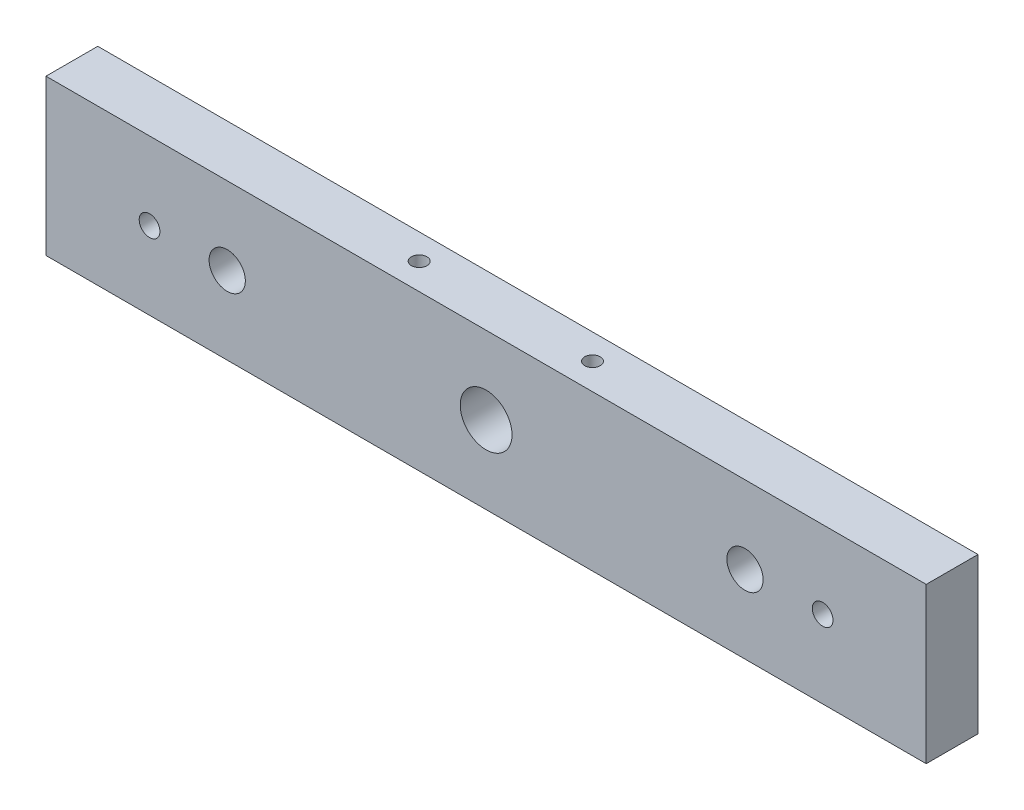
from build123d import *

# Parameters (mm, degrees)
ESBO_O1_W                 = 170
ESBO_O1_H                 = 30
ESBO_O1_R                 = 5
ESBO_O1_R_2               = 3.5
ESBO_O1_R_3               = 2
RESSALTO_EXTRUS_O1_DEPTH  = 10
CORTE_EXTRUS_O1_START     = 26.451612903
CORTE_EXTRUS_O1_OUTLINE_R = 1.5
CORTE_EXTRUS_O1_DEPTH     = 30


# Read off the part's stored shape, not the designer's step: Corte-extrusão1
with BuildPart() as part:
    # Esboço1 → Ressalto-extrusão1 (new body)
    with BuildSketch(Plane.XY):
        with Locations((-192.217741935, 41.451612903)):
            Rectangle(ESBO_O1_W, ESBO_O1_H)
        with Locations((-192.217741935, 41.451612903)):
            Circle(ESBO_O1_R, mode=Mode.SUBTRACT)
        with Locations((-242.217741935, 41.451612903)):
            Circle(ESBO_O1_R_2, mode=Mode.SUBTRACT)
        with Locations((-142.217741935, 41.451612903)):
            Circle(ESBO_O1_R_2, mode=Mode.SUBTRACT)
        with Locations((-257.217741935, 41.451612903)):
            Circle(ESBO_O1_R_3, mode=Mode.SUBTRACT)
        with Locations((-127.217741935, 41.451612903)):
            Circle(ESBO_O1_R_3, mode=Mode.SUBTRACT)
    extrude(amount=RESSALTO_EXTRUS_O1_DEPTH)

    # Corte-extrusão1 outline → Corte-extrusão1 (cut)
    with BuildSketch(Plane(origin=(0, 0, 0), x_dir=(1, 0, 0), z_dir=(0, 1, 0)).offset(CORTE_EXTRUS_O1_START)):
        with Locations((-210.23272287, -4.918113723)):
            Circle(CORTE_EXTRUS_O1_OUTLINE_R)
        with Locations((-176.768107745, -4.912217988)):
            Circle(CORTE_EXTRUS_O1_OUTLINE_R)
    extrude(amount=CORTE_EXTRUS_O1_DEPTH, mode=Mode.SUBTRACT)


solid = part.part
